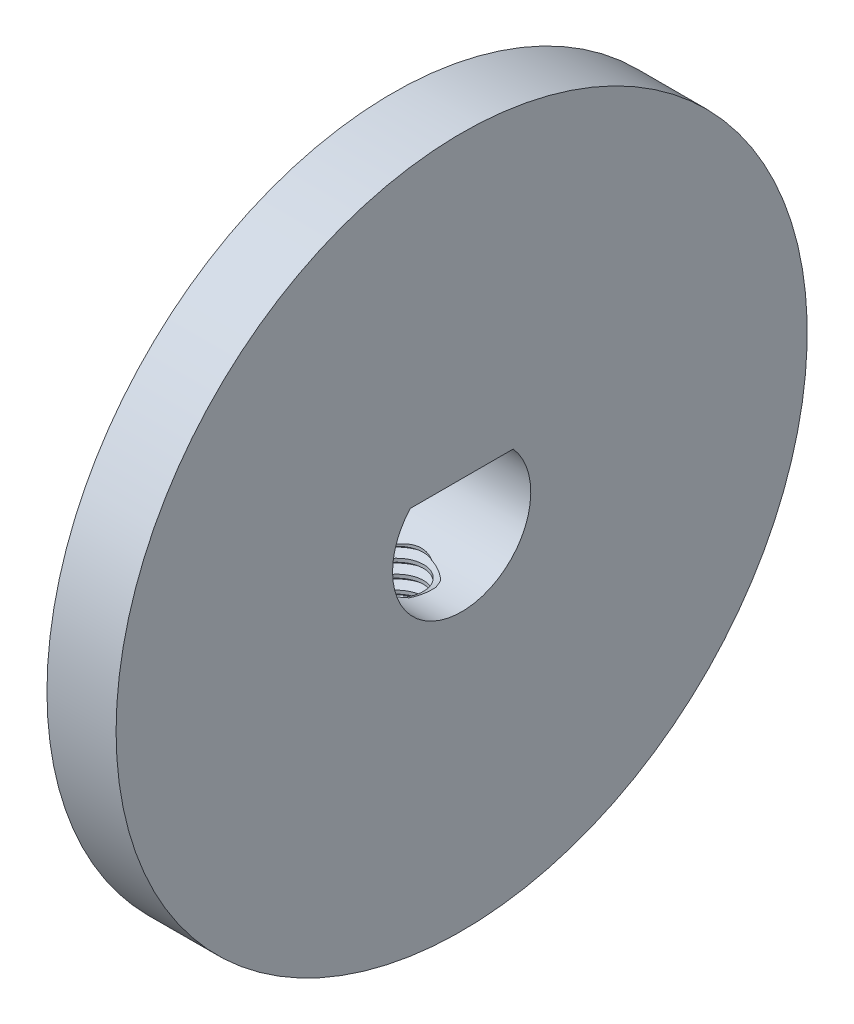
from build123d import *
from build123d.topology import SkipClean

# Parameters (mm, degrees)
BOSS_EXTRUDE5_START     = -3
BOSS_EXTRUDE5_DEPTH     = 3
CUT_EXTRUDE2_REACH      = 45.452
CUT_EXTRUDE2_END_RADIUS = 6
CUT_EXTRUDE2_START      = 20
SKETCH4_R               = 2
SKETCH7_W               = 1.25
SKETCH7_H               = 17
THREAD1_PITCH           = 0.6


with BuildPart() as part:
    # Sketch2 → Revolve1 (revolve)
    with BuildSketch(Plane.XY, mode=Mode.PRIVATE) as revolve1_sk:
        Polygon((0, -3), (0, -6), (3, -6), (3, -15), (6, -15), (6, -3), align=None)
    revolve(revolve1_sk.sketch.rotate(Axis((0, 0, 0), (1, 0, 0)), 270), axis=Axis((0, 0, 0), (1, 0, 0)))

    # Sketch3 → Boss-Extrude5 (add)
    with BuildSketch(Plane(origin=(6, 0, 0), x_dir=(0, 0, -1), z_dir=(1, 0, 0)).offset(BOSS_EXTRUDE5_START)):
        with BuildLine():
            Line((-2.236067977, 2), (2.236067977, 2))
            ThreePointArc((2.236067977, 2), (0, 3), (-2.236067977, 2))
        make_face()
    extrude(amount=BOSS_EXTRUDE5_DEPTH)

    # Cut-Extrude2: up to this cylinder (the profile starts outside it)
    with SkipClean():  # the faces are left unmerged after this step: merging them gives an invalid solid
        cut_extrude2_end = Plane(origin=(3, 0, 0), z_dir=(-1, 0, 0)) * Cylinder(CUT_EXTRUDE2_END_RADIUS, 103.904, mode=Mode.PRIVATE)
        # Sketch4 → Cut-Extrude2 (cut, up to the surface)
        with BuildSketch(Plane.XZ.offset(-2).offset(CUT_EXTRUDE2_START), mode=Mode.PRIVATE) as cut_extrude2_sk1:
            with Locations((3, 0)):
                Circle(SKETCH4_R)
        cut_extrude2_tool1 = extrude(cut_extrude2_sk1.sketch, amount=-CUT_EXTRUDE2_REACH, mode=Mode.PRIVATE) - cut_extrude2_end
        add(cut_extrude2_tool1.solids().sort_by_distance((3, -18, 0))[0], mode=Mode.SUBTRACT)

    # Sketch7 → M3x0.5 Tapped Hole1 (revolve, cut)
    with BuildSketch(Plane(origin=(3, 2, 0), x_dir=(0, 0, 1), z_dir=(1, 0, 0))):
        with Locations((0.625, 8.5)):
            Rectangle(SKETCH7_W, SKETCH7_H)
    revolve(axis=Axis((3, 8.35, 0), (0, -1, 0)), mode=Mode.SUBTRACT)

    # Thread1: the profile of Thread Profile1 profile screwed along a left-hand helix of 16.666667 turns, 6 arcs to a turn; built about Z, then put on its axis
    thread1_z = Axis((0, 0, 0), (0, 0, 1))
    thread1_corners = [(1.2497, 0, -0.000173205), (1.574759525, 0, 0.187499999), (1.574759525, 0, 0.262499999), (1.2497, 0, 0.450173203)]
    with BuildLine(mode=Mode.PRIVATE) as thread1_profile:
        Line(thread1_corners[0], thread1_corners[1])
        Line(thread1_corners[1], thread1_corners[2])
        Line(thread1_corners[2], thread1_corners[3])
        Line(thread1_corners[3], thread1_corners[0])
    thread1_cap = Face(thread1_profile.wire())
    thread1_turn_angles = [0, -30, -60, -90, -120, -150, -180, -210, -240, -270, -300, -330, -360]
    thread1_turn_weights = [1, 0.8660254037844387, 1, 0.8660254037844387, 1, 0.8660254037844387, 1, 0.8660254037844387, 1, 0.8660254037844387, 1, 0.8660254037844387, 1]
    thread1_turn_rails = [Edge.make_bspline([Vector(p[0], p[1], 0).rotate(thread1_z, thread1_turn_angles[k]) / thread1_turn_weights[k] + Vector(0, 0, p[2] + -THREAD1_PITCH * thread1_turn_angles[k] / 360) for k in range(13)], [0, 0, 0, 1, 1, 2, 2, 3, 3, 4, 4, 5, 5, 6, 6, 6], 2, thread1_turn_weights) for p in thread1_corners]
    thread1_turn_sides = [Face.make_surface_from_curves(thread1_turn_rails[p[0]], thread1_turn_rails[p[1]]) for p in [(0, 1), (1, 2), (2, 3), (3, 0)]]
    thread1_last_angles = [-5760, -5790, -5820, -5850, -5880, -5910, -5940, -5970, -6000]
    thread1_last_weights = [1, 0.8660254037844387, 1, 0.8660254037844387, 1, 0.8660254037844387, 1, 0.8660254037844387, 1]
    thread1_last_rails = [Edge.make_bspline([Vector(p[0], p[1], 0).rotate(thread1_z, thread1_last_angles[k]) / thread1_last_weights[k] + Vector(0, 0, p[2] + -THREAD1_PITCH * thread1_last_angles[k] / 360) for k in range(9)], [0, 0, 0, 1, 1, 2, 2, 3, 3, 4, 4, 4], 2, thread1_last_weights) for p in thread1_corners]
    thread1_last_sides = [Face.make_surface_from_curves(thread1_last_rails[p[0]], thread1_last_rails[p[1]]) for p in [(0, 1), (1, 2), (2, 3), (3, 0)]]
    thread1 = Plane(origin=(3, 0, 0), x_dir=(-1, 0, 0), z_dir=(0, -1, 0)) * Solid(Shell([*[p.moved(Location((0, 0, THREAD1_PITCH * i))) for i in range(16) for p in thread1_turn_sides], *thread1_last_sides, thread1_cap, thread1_cap.rotate(thread1_z, -6000).moved(Location((0, 0, -THREAD1_PITCH * -6000 / 360)))]))
    add(thread1, mode=Mode.SUBTRACT)


solid = part.part
